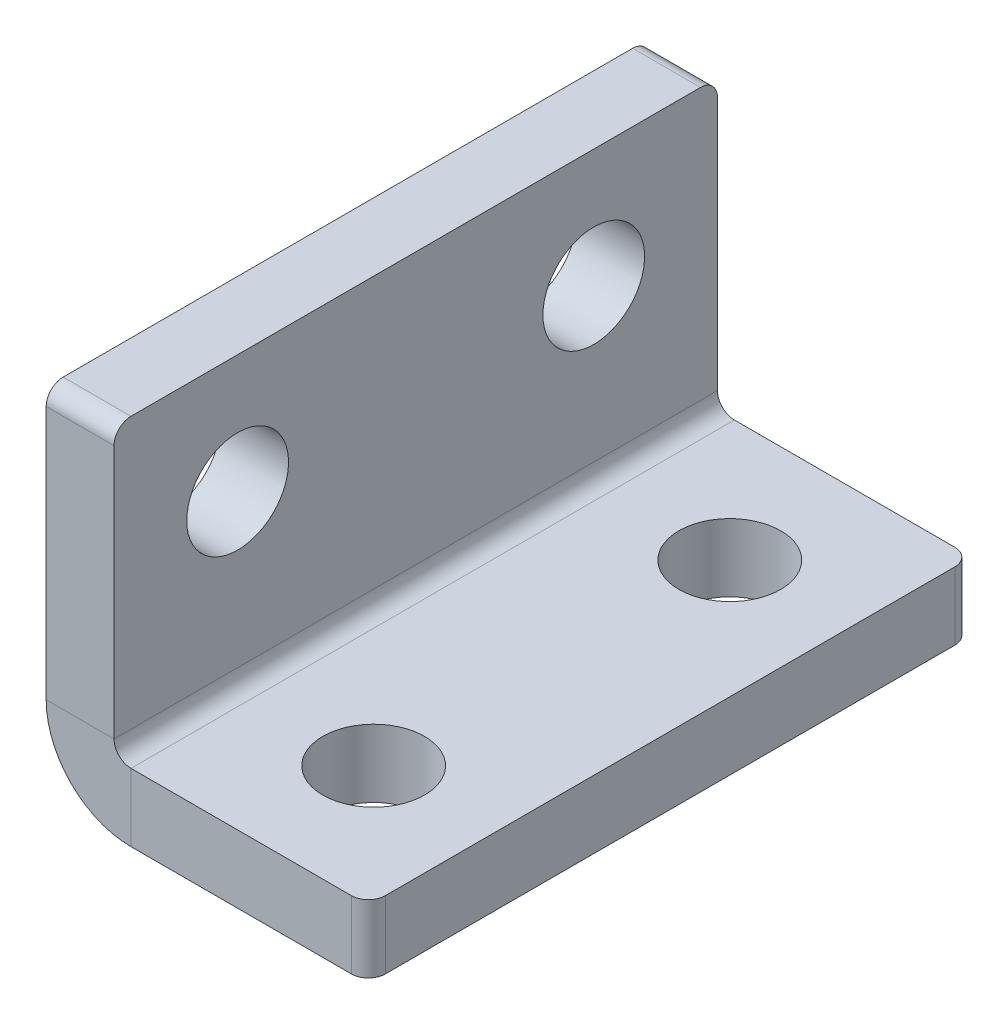
from build123d import *

# Parameters (mm, degrees)
SKETCH2_W                  = 15
SKETCH2_H                  = 17.79
SKETCH2_R                  = 1.5
BASE_FLANGE1_DEPTH         = 2
SKETCHED_BEND6_OUTLINE_W   = 2
SKETCHED_BEND6_OUTLINE_H   = 17.79
SKETCHED_BEND6_DEPTH       = 5.5
SKETCHED_START             = 5.74315
SKETCHED_BEND6_2_OUTLINE_W = 8.49
SKETCHED_BEND6_2_OUTLINE_H = 17.79
SKETCHED_BEND6_2_OUTLINE_R = 1.5
SKETCHED_BEND6_2_DEPTH     = 1.75685
SKETCHED_START_2           = 5.5
SKETCHED_BEND6_3_OUTLINE_W = 8.49
SKETCHED_BEND6_3_OUTLINE_H = 17.79
SKETCHED_BEND6_3_OUTLINE_R = 1.5
SKETCHED_BEND6_3_DEPTH     = 2.5
SKETCHED_START_3           = -17.79
SKETCHED_BEND6_4_DEPTH     = 17.79
FILLET1_R                  = 0.5


with BuildPart() as part:
    # Base-Flange1: sheet metal written as solids
    # Sketch2 → Base-Flange1 (new body)
    with BuildSketch(Plane(origin=(0, 0, 0), x_dir=(1, 0, 0), z_dir=(0, 1, 0))):
        with Locations((7.5, 8.895)):
            Rectangle(SKETCH2_W, SKETCH2_H)
        with Locations(Location((11.51, 14.145, 0), (0, 0, 270))):
            Circle(SKETCH2_R, mode=Mode.SUBTRACT)
        with Locations(Location((11.51, 3.645, 0), (0, 0, 270))):
            Circle(SKETCH2_R, mode=Mode.SUBTRACT)
        with Locations(Location((3.49, 3.645, 0), (0, 0, 270))):
            Circle(SKETCH2_R, mode=Mode.SUBTRACT)
        with Locations(Location((3.49, 14.145, 0), (0, 0, 270))):
            Circle(SKETCH2_R, mode=Mode.SUBTRACT)
    extrude(amount=-BASE_FLANGE1_DEPTH)

    # Sketched Bend6: read off the stored shape, not the designer's step
    # Sketched Bend6 outline → Sketched Bend6 (cut)
    with BuildSketch(Plane.YZ):
        with Locations((-1, -8.895)):
            Rectangle(SKETCHED_BEND6_OUTLINE_W, SKETCHED_BEND6_OUTLINE_H)
    extrude(amount=SKETCHED_BEND6_DEPTH, mode=Mode.SUBTRACT)

    # Sketched Bend6 2 outline → Sketched Bend6 2 (add)
    with BuildSketch(Plane.YZ.offset(SKETCHED_START)):
        with Locations((4.245, -8.895)):
            Rectangle(SKETCHED_BEND6_2_OUTLINE_W, SKETCHED_BEND6_2_OUTLINE_H)
        with Locations((5, -14.145)):
            Circle(SKETCHED_BEND6_2_OUTLINE_R, mode=Mode.SUBTRACT)
        with Locations((5, -3.645)):
            Circle(SKETCHED_BEND6_2_OUTLINE_R, mode=Mode.SUBTRACT)
    extrude(amount=SKETCHED_BEND6_2_DEPTH)

    # Sketched Bend6 3 outline → Sketched Bend6 3 (add)
    with BuildSketch(Plane.YZ.offset(SKETCHED_START_2)):
        with Locations((4.245, -8.895)):
            Rectangle(SKETCHED_BEND6_3_OUTLINE_W, SKETCHED_BEND6_3_OUTLINE_H)
        with Locations((5, -14.145)):
            Circle(SKETCHED_BEND6_3_OUTLINE_R, mode=Mode.SUBTRACT)
        with Locations((5, -3.645)):
            Circle(SKETCHED_BEND6_3_OUTLINE_R, mode=Mode.SUBTRACT)
    extrude(amount=SKETCHED_BEND6_3_DEPTH)

    # Sketched Bend6 4 outline → Sketched Bend6 4 (cut)
    with BuildSketch(Plane.XY.offset(SKETCHED_START_3)):
        with BuildLine():
            Line((8, 8.49), (7.5, 8.49))
            Line((7.5, 8.49), (7.5, 0.5))
            ThreePointArc((7.5, 0.5), (7.646446609, 0.146446609), (8, 0))
            Line((8, 0), (8, 8.49))
        make_face()
        with BuildLine():
            ThreePointArc((8, -2), (6.232233047, -1.267766953), (5.5, 0.5))
            Line((5.5, 0.5), (5.5, -2))
            Line((5.5, -2), (8, -2))
        make_face()
    extrude(amount=SKETCHED_BEND6_4_DEPTH, mode=Mode.SUBTRACT)

    # Fillet1
    fillet1_edges = [part.edges().sort_by_distance(p)[0] for p in [
        (15, -1, -17.79),
        (15, -1, 0),
        (6.5, 8.49, -17.79),
        (6.5, 8.49, 0),
    ]]
    fillet(fillet1_edges, radius=FILLET1_R)


solid = part.part
